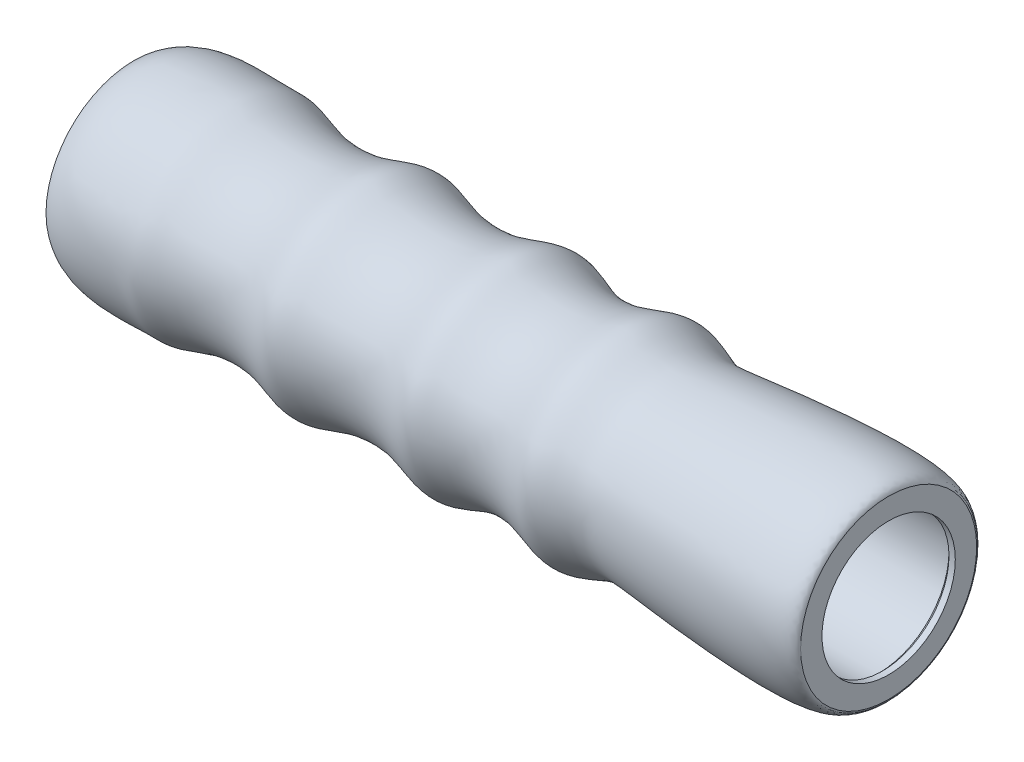
from build123d import *
from build123d.topology import SkipClean

# Parameters (mm, degrees)
SKETCH1_R           = 13.5
SKETCH1_R_2         = 11.2
BOSS_EXTRUDE1_DEPTH = 60
CIRPATTERN1_COUNT   = 8
LPATTERN1_COUNT     = 3
LPATTERN1_PITCH     = 20
FILLET1_R           = 3
SKETCH4_R           = 11.2
SKETCH4_R_2         = 10.6
BOSS_EXTRUDE2_DEPTH = 1
CHAMFER1_SIZE       = 0.6


# Some blends are built 0.0001 mm under size
with BuildPart() as part:
    # Sketch1 → Boss-Extrude1 (new body)
    with BuildSketch(Plane(origin=(0, 0, 0), x_dir=(0, 0, -1), z_dir=(1, 0, 0))):
        Circle(SKETCH1_R)
        Circle(SKETCH1_R_2, mode=Mode.SUBTRACT)
    extrude(amount=BOSS_EXTRUDE1_DEPTH)

    # Sketch2 → Cut-Revolve1 (revolve, cut)
    with BuildSketch(Plane.XY):
        with BuildLine():
            Line((8, 12.6), (8, 9.6))
            Line((8, 9.6), (11, 9.6))
            ThreePointArc((11, 9.6), (10.121320344, 11.721320344), (8, 12.6))
        make_face()
    cut_revolve1 = revolve(axis=Axis((8, 12.6, 0), (0, -1, 0)), mode=Mode.SUBTRACT)

    # CirPattern1: Cut-Revolve1 ×8 about axis
    cirpattern1_axis = Axis((0, 0, 0), (1, 0, 0))
    for i in range(1, CIRPATTERN1_COUNT):
        add(cut_revolve1.rotate(cirpattern1_axis, i * 360 / CIRPATTERN1_COUNT), mode=Mode.SUBTRACT)

    # LPattern1: Cut-Revolve1 ×3
    with Locations(*[(i * LPATTERN1_PITCH, 0, 0) for i in range(1, LPATTERN1_COUNT)]):
        add(cut_revolve1, mode=Mode.SUBTRACT)

    # LPattern1 copy 1 sketch → LPattern1 copy 1 (revolve, cut)
    with BuildSketch(Plane(origin=(20, 0, 0), x_dir=(1, 0, 0), z_dir=(0, -0.7071067811865475, 0.7071067811865476))):
        with BuildLine():
            Line((8, 12.6), (8, 9.6))
            Line((8, 9.6), (11, 9.6))
            ThreePointArc((11, 9.6), (10.121320344, 11.721320344), (8, 12.6))
        make_face()
    revolve(axis=Axis((28, 8.909545443, 8.909545443), (0, -0.7071067811865476, -0.7071067811865475)), mode=Mode.SUBTRACT)

    # LPattern1 copy 2 sketch → LPattern1 copy 2 (revolve, cut)
    with BuildSketch(Plane(origin=(40, 0, 0), x_dir=(1, 0, 0), z_dir=(0, -0.7071067811865475, 0.7071067811865476))):
        with BuildLine():
            Line((8, 12.6), (8, 9.6))
            Line((8, 9.6), (11, 9.6))
            ThreePointArc((11, 9.6), (10.121320344, 11.721320344), (8, 12.6))
        make_face()
    revolve(axis=Axis((48, 8.909545443, 8.909545443), (0, -0.7071067811865476, -0.7071067811865475)), mode=Mode.SUBTRACT)

    # LPattern1 copy 3 sketch → LPattern1 copy 3 (revolve, cut)
    with BuildSketch(Plane(origin=(20, 0, 0), x_dir=(1, 0, 0), z_dir=(0, -1, 0))):
        with BuildLine():
            Line((8, 12.6), (8, 9.6))
            Line((8, 9.6), (11, 9.6))
            ThreePointArc((11, 9.6), (10.121320344, 11.721320344), (8, 12.6))
        make_face()
    revolve(axis=Axis((28, 0, 12.6), (0, 0, -1)), mode=Mode.SUBTRACT)

    # LPattern1 copy 4 sketch → LPattern1 copy 4 (revolve, cut)
    with BuildSketch(Plane(origin=(40, 0, 0), x_dir=(1, 0, 0), z_dir=(0, -1, 0))):
        with BuildLine():
            Line((8, 12.6), (8, 9.6))
            Line((8, 9.6), (11, 9.6))
            ThreePointArc((11, 9.6), (10.121320344, 11.721320344), (8, 12.6))
        make_face()
    revolve(axis=Axis((48, 0, 12.6), (0, 0, -1)), mode=Mode.SUBTRACT)

    # LPattern1 copy 5 sketch → LPattern1 copy 5 (revolve, cut)
    with BuildSketch(Plane(origin=(20, 0, 0), x_dir=(1, 0, 0), z_dir=(0, -0.7071067811865476, -0.7071067811865475))):
        with BuildLine():
            Line((8, 12.6), (8, 9.6))
            Line((8, 9.6), (11, 9.6))
            ThreePointArc((11, 9.6), (10.121320344, 11.721320344), (8, 12.6))
        make_face()
    revolve(axis=Axis((28, -8.909545443, 8.909545443), (0, 0.7071067811865475, -0.7071067811865476)), mode=Mode.SUBTRACT)

    # LPattern1 copy 6 sketch → LPattern1 copy 6 (revolve, cut)
    with BuildSketch(Plane(origin=(40, 0, 0), x_dir=(1, 0, 0), z_dir=(0, -0.7071067811865476, -0.7071067811865475))):
        with BuildLine():
            Line((8, 12.6), (8, 9.6))
            Line((8, 9.6), (11, 9.6))
            ThreePointArc((11, 9.6), (10.121320344, 11.721320344), (8, 12.6))
        make_face()
    revolve(axis=Axis((48, -8.909545443, 8.909545443), (0, 0.7071067811865475, -0.7071067811865476)), mode=Mode.SUBTRACT)

    # LPattern1 copy 7 sketch → LPattern1 copy 7 (revolve, cut)
    with BuildSketch(Plane(origin=(20, 0, 0), x_dir=(1, 0, 0), z_dir=(0, 0, -1))):
        with BuildLine():
            Line((8, 12.6), (8, 9.6))
            Line((8, 9.6), (11, 9.6))
            ThreePointArc((11, 9.6), (10.121320344, 11.721320344), (8, 12.6))
        make_face()
    revolve(axis=Axis((28, -12.6, 0), (0, 1, 0)), mode=Mode.SUBTRACT)

    # LPattern1 copy 8 sketch → LPattern1 copy 8 (revolve, cut)
    with BuildSketch(Plane(origin=(40, 0, 0), x_dir=(1, 0, 0), z_dir=(0, 0, -1))):
        with BuildLine():
            Line((8, 12.6), (8, 9.6))
            Line((8, 9.6), (11, 9.6))
            ThreePointArc((11, 9.6), (10.121320344, 11.721320344), (8, 12.6))
        make_face()
    revolve(axis=Axis((48, -12.6, 0), (0, 1, 0)), mode=Mode.SUBTRACT)

    # LPattern1 copy 9 sketch → LPattern1 copy 9 (revolve, cut)
    with BuildSketch(Plane(origin=(20, 0, 0), x_dir=(1, 0, 0), z_dir=(0, 0.7071067811865475, -0.7071067811865477))):
        with BuildLine():
            Line((8, 12.6), (8, 9.6))
            Line((8, 9.6), (11, 9.6))
            ThreePointArc((11, 9.6), (10.121320344, 11.721320344), (8, 12.6))
        make_face()
    revolve(axis=Axis((28, -8.909545443, -8.909545443), (0, 0.7071067811865477, 0.7071067811865475)), mode=Mode.SUBTRACT)

    # LPattern1 copy 10 sketch → LPattern1 copy 10 (revolve, cut)
    with BuildSketch(Plane(origin=(40, 0, 0), x_dir=(1, 0, 0), z_dir=(0, 0.7071067811865475, -0.7071067811865477))):
        with BuildLine():
            Line((8, 12.6), (8, 9.6))
            Line((8, 9.6), (11, 9.6))
            ThreePointArc((11, 9.6), (10.121320344, 11.721320344), (8, 12.6))
        make_face()
    revolve(axis=Axis((48, -8.909545443, -8.909545443), (0, 0.7071067811865477, 0.7071067811865475)), mode=Mode.SUBTRACT)

    # LPattern1 copy 11 sketch → LPattern1 copy 11 (revolve, cut)
    with BuildSketch(Plane(origin=(20, 0, 0), x_dir=(1, 0, 0), z_dir=(0, 1, 0))):
        with BuildLine():
            Line((8, 12.6), (8, 9.6))
            Line((8, 9.6), (11, 9.6))
            ThreePointArc((11, 9.6), (10.121320344, 11.721320344), (8, 12.6))
        make_face()
    revolve(axis=Axis((28, 0, -12.6), (0, 0, 1)), mode=Mode.SUBTRACT)

    # LPattern1 copy 12 sketch → LPattern1 copy 12 (revolve, cut)
    with BuildSketch(Plane(origin=(40, 0, 0), x_dir=(1, 0, 0), z_dir=(0, 1, 0))):
        with BuildLine():
            Line((8, 12.6), (8, 9.6))
            Line((8, 9.6), (11, 9.6))
            ThreePointArc((11, 9.6), (10.121320344, 11.721320344), (8, 12.6))
        make_face()
    revolve(axis=Axis((48, 0, -12.6), (0, 0, 1)), mode=Mode.SUBTRACT)

    # LPattern1 copy 13 sketch → LPattern1 copy 13 (revolve, cut)
    with BuildSketch(Plane(origin=(20, 0, 0), x_dir=(1, 0, 0), z_dir=(0, 0.7071067811865477, 0.7071067811865474))):
        with BuildLine():
            Line((8, 12.6), (8, 9.6))
            Line((8, 9.6), (11, 9.6))
            ThreePointArc((11, 9.6), (10.121320344, 11.721320344), (8, 12.6))
        make_face()
    revolve(axis=Axis((28, 8.909545443, -8.909545443), (0, -0.7071067811865474, 0.7071067811865477)), mode=Mode.SUBTRACT)

    # LPattern1 copy 14 sketch → LPattern1 copy 14 (revolve, cut)
    with BuildSketch(Plane(origin=(40, 0, 0), x_dir=(1, 0, 0), z_dir=(0, 0.7071067811865477, 0.7071067811865474))):
        with BuildLine():
            Line((8, 12.6), (8, 9.6))
            Line((8, 9.6), (11, 9.6))
            ThreePointArc((11, 9.6), (10.121320344, 11.721320344), (8, 12.6))
        make_face()
    revolve(axis=Axis((48, 8.909545443, -8.909545443), (0, -0.7071067811865474, 0.7071067811865477)), mode=Mode.SUBTRACT)

    # Fillet1
    # the kernel refuses this fillet: 3 mm, written as the material it takes off along each edge
    with BuildSketch(Plane(origin=(0, 0, 0), x_dir=(0, 0, -1), z_dir=(0, -1, 0))) as fillet1_piece_1:
        with BuildLine():
            CenterArc((14.2, 2.917190429), FILLET1_R, 180, 76.506601178)
            Line((11.2, 2.917190429), (11.14, 2.917190429))
            Line((11.14, 2.917190429), (11.14, 0))
            Line((11.14, 0), (11.2, -0.06))
            ThreePointArc((11.2, -0.06), (12.35, -0.06), (13.486, -0.058343809))
            Line((13.486, -0.058343809), (13.5, 0))
        make_face()
    revolve(axis=Axis((0, 0, 0), (1, 0, 0)), mode=Mode.SUBTRACT)

    # Sketch3 → Revolve1 (revolve)
    with SkipClean():  # the faces are left unmerged after this step: merging them gives an invalid solid
        with BuildSketch(Plane.XY, mode=Mode.PRIVATE) as revolve1_sk:
            with BuildLine():
                Line((60, 11.2), (120, 11.2))
                Line((120, 11.2), (120, 14))
                add(Edge.make_bspline(
                    [(0, 14), (3.546048391, 16.770476639), (11.482496003, 15.766296553), (17.1108905, 16.170265212), (20.830442594, 13.973616768), (31.247503395, 13.992124232), (34.599568332, 15.965142158), (39.006388121, 16.062353847), (42.563294309, 14.003358856), (52.980988178, 13.964608713), (56.385718175, 15.889930701), (60.775091943, 16.1131269), (64.171514581, 13.952516721), (72.258011684, 14.015809659), (75.973288401, 16.015713516), (80.036854944, 16.018313868), (83.861294239, 13.753782538), (92.081113156, 14.486467155), (119.400913787, 17.397586748), (120, 14)],
                    knots=[0, 0, 0, 0, 0.14950798, 0.178017685, 0.273199344, 0.297139956, 0.3934832, 0.415958113, 0.499414174, 0.519547464, 0.597157725, 0.61397214, 0.6708772, 0.685760261, 0.747919697, 0.763484341, 0.825842055, 0.850273092, 1, 1, 1, 1], degree=3))
                Line((0, 14), (0, 13.5))
                Line((0, 13.5), (60, 13.5))
                Line((60, 13.5), (60, 11.2))
            make_face()
        revolve(revolve1_sk.sketch.rotate(Axis((0, 0, 0), (1, 0, 0)), 90), axis=Axis((0, 0, 0), (1, 0, 0)))
    add(part.part.scale(1), mode=Mode.REPLACE)  # the faces are merged on a copy

    # Sketch4 → Boss-Extrude2 (add)
    with SkipClean():  # the faces are left unmerged after this step: merging them gives an invalid solid
        with BuildSketch(Plane(origin=(120, 0, 0), x_dir=(0, 0, -1), z_dir=(1, 0, 0))):
            with Locations(Location((0, 0, 0), (0, 0, 180))):
                Circle(SKETCH4_R)
            Circle(SKETCH4_R_2, mode=Mode.SUBTRACT)
        extrude(amount=-BOSS_EXTRUDE2_DEPTH)

    # Chamfer1
    chamfer1_edges = [part.edges().sort_by_distance(p)[0] for p in [
        (119, 0, -11.2),
    ]]
    chamfer(chamfer1_edges, length=CHAMFER1_SIZE - 0.0001)  # a hair under: the kernel refuses the full size


solid = part.part
